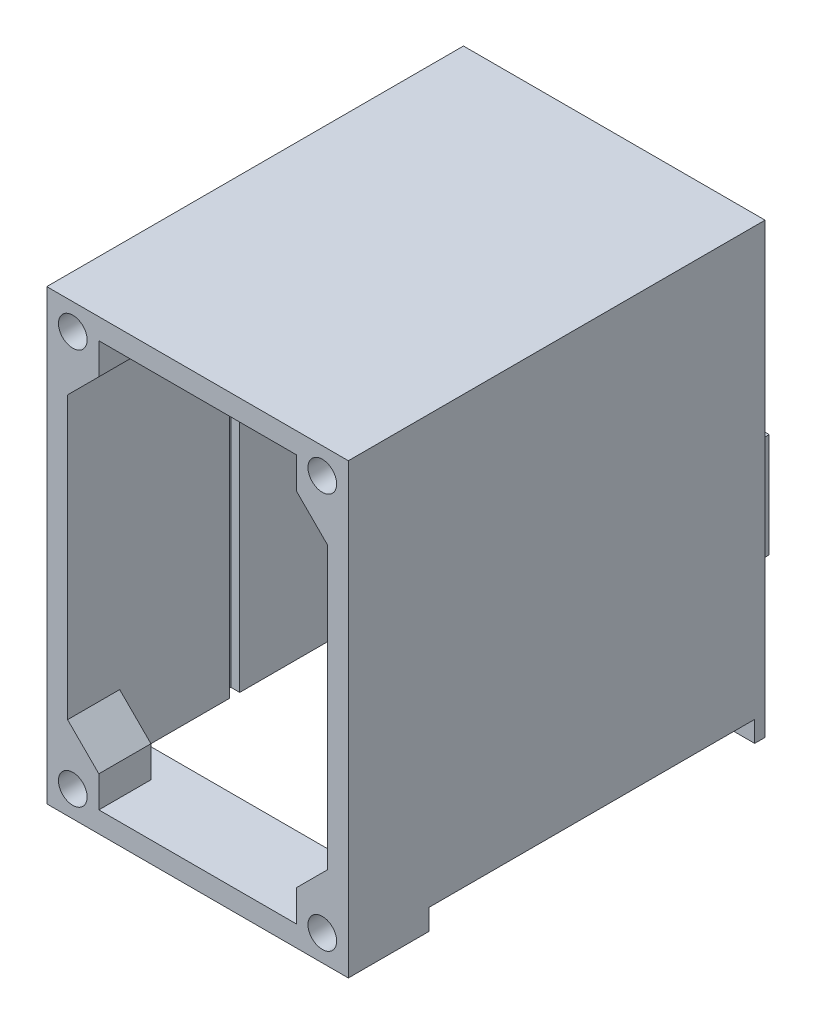
from build123d import *

# Parameters (mm, degrees)
ESQUISSE1_W              = 57.9
ESQUISSE1_H              = 86
BOSS_EXTRU_1_DEPTH       = 80
ESQUISSE2_W              = 49.9
ESQUISSE2_H              = 78
ENL_V_MAT_EXTRU_1_DEPTH  = 75
ESQUISSE3_W              = 10
ESQUISSE3_H              = 10
BOSS_EXTRU_2_DEPTH       = 10
ESQUISSE4_R              = 2.75
ENL_V_MAT_EXTRU_2_DEPTH  = 5.85
ESQUISSE47_R             = 2.25
ENL_V_MAT_EXTRU_25_DEPTH = 10
ESQUISSE19_W             = 50
ESQUISSE19_H             = 20
BOSS_EXTRU_9_DEPTH       = 4.75
CONG_1_R                 = 3
ESQUISSE29_W             = 10
ESQUISSE29_H             = 5
ENL_V_MAT_EXTRU_11_DEPTH = 100.346187647
ESQUISSE32_W             = 57.9
ESQUISSE32_H             = 62.5
ENL_V_MAT_EXTRU_16_DEPTH = 4
ESQUISSE46_W             = 3
ESQUISSE46_H             = 5.5
BOSS_EXTRU_10_DEPTH      = 78
ENL_V_START              = -1.5
ENL_V_MAT_EXTRU_20_DEPTH = 11.5
ENL_V_MAT_EXTRU_21_DEPTH = 1.7
CHANFREIN1_SIZE          = 6
ESQUISSE45_R             = 2.75
ENL_V_MAT_EXTRU_24_DEPTH = 100.346187647
ESQUISSE48_W             = 8
ESQUISSE48_H             = 4
BOSS_EXTRU_11_DEPTH      = 15
ESQUISSE49_R             = 2.75
ENL_V_MAT_EXTRU_26_DEPTH = 15
CONG_2_R                 = 2


with BuildPart() as part:
    # Esquisse1 → Boss.-Extru.1 (new body)
    with BuildSketch(Plane.XY):
        Rectangle(ESQUISSE1_W, ESQUISSE1_H)
    extrude(amount=BOSS_EXTRU_1_DEPTH)

    # Esquisse2 → Enlèv. mat.-Extru.1 (cut)
    with BuildSketch(Plane.XY.offset(80)):
        Rectangle(ESQUISSE2_W, ESQUISSE2_H)
    extrude(amount=-ENL_V_MAT_EXTRU_1_DEPTH, mode=Mode.SUBTRACT)

    # Esquisse3 → Boss.-Extru.2 (add)
    with BuildSketch(Plane.XY.offset(80)):
        with Locations((-23.95, 38)):
            Rectangle(ESQUISSE3_W, ESQUISSE3_H)
        with Locations((-23.95, -38)):
            Rectangle(ESQUISSE3_W, ESQUISSE3_H)
        with Locations((23.95, -38)):
            Rectangle(ESQUISSE3_W, ESQUISSE3_H)
        with Locations((23.95, 38)):
            Rectangle(ESQUISSE3_W, ESQUISSE3_H)
    extrude(amount=-BOSS_EXTRU_2_DEPTH)

    # Esquisse4 → Enlèv. mat.-Extru.2 (cut)
    with BuildSketch(Plane.XY.offset(80)):
        with Locations((23.95, -38)):
            Circle(ESQUISSE4_R)
        with Locations((-23.95, -38)):
            Circle(ESQUISSE4_R)
        with Locations((-23.95, 38)):
            Circle(ESQUISSE4_R)
        with Locations((23.95, 38)):
            Circle(ESQUISSE4_R)
    extrude(amount=-ENL_V_MAT_EXTRU_2_DEPTH, mode=Mode.SUBTRACT)

    # Esquisse47 → Enlèv. mat.-Extru.25 (cut)
    with BuildSketch(Plane.XY.offset(80)):
        with Locations((23.95, -38)):
            Circle(ESQUISSE47_R)
        with Locations((-23.95, -38)):
            Circle(ESQUISSE47_R)
        with Locations((-23.95, 38)):
            Circle(ESQUISSE47_R)
        with Locations((23.95, 38)):
            Circle(ESQUISSE47_R)
    extrude(amount=-ENL_V_MAT_EXTRU_25_DEPTH, mode=Mode.SUBTRACT)

    # Esquisse19 → Boss.-Extru.9 (add)
    with BuildSketch(Plane(origin=(0, 0, 0), x_dir=(-1, 0, 0), z_dir=(0, 0, -1))):
        with Locations((0, -7)):
            Rectangle(ESQUISSE19_W, ESQUISSE19_H)
    extrude(amount=BOSS_EXTRU_9_DEPTH)

    # Congé1
    cong_1_edges = [part.edges().sort_by_distance(p)[0] for p in [
        (0, -17, 0),
    ]]
    fillet(cong_1_edges, radius=CONG_1_R)

    # Esquisse29 → Enlèv. mat.-Extru.11 (cut, through all)
    with BuildSketch(Plane(origin=(0, 0, -4.75), x_dir=(-1, 0, 0), z_dir=(0, 0, -1))):
        with Locations((0, -5)):
            Rectangle(ESQUISSE29_W, ESQUISSE29_H)
    extrude(amount=-ENL_V_MAT_EXTRU_11_DEPTH, mode=Mode.SUBTRACT)

    # Esquisse32 → Enlèv. mat.-Extru.16 (cut)
    with BuildSketch(Plane.XZ.offset(43)):
        with Locations((0, 33.25)):
            Rectangle(ESQUISSE32_W, ESQUISSE32_H)
    extrude(amount=-ENL_V_MAT_EXTRU_16_DEPTH, mode=Mode.SUBTRACT)

    # Esquisse46 → Boss.-Extru.10 (add)
    with BuildSketch(Plane.XZ.offset(39)):
        with Locations((-23.45, 15.75)):
            Rectangle(ESQUISSE46_W, ESQUISSE46_H)
    boss_extru_10 = extrude(amount=-BOSS_EXTRU_10_DEPTH)

    # Esquisse38 → Enlèv. mat.-Extru.20 (cut)
    with BuildSketch(Plane(origin=(-24.95, 0, 0), x_dir=(0, 0, -1), z_dir=(1, 0, 0)).offset(ENL_V_START)):
        with BuildLine():
            Line((-16.95, -39), (-16.95, 36))
            ThreePointArc((-16.95, 36), (-15.975, 36.975), (-15, 36))
            Line((-15, 36), (-15, -39))
            ThreePointArc((-15, -39), (-15.975, -39.975), (-16.95, -39))
        make_face()
    enl_v_mat_extru_20 = extrude(amount=ENL_V_MAT_EXTRU_20_DEPTH, mode=Mode.SUBTRACT)

    # Esquisse40 → Enlèv. mat.-Extru.21 (cut)
    with BuildSketch(Plane(origin=(-24.95, 0, 0), x_dir=(0, 0, -1), z_dir=(1, 0, 0))):
        with BuildLine():
            Line((-46.95, 36), (-46.95, -39))
            ThreePointArc((-46.95, -39), (-47.925, -39.975), (-48.9, -39))
            Line((-48.9, -39), (-48.9, 36))
            ThreePointArc((-48.9, 36), (-47.925, 36.975), (-46.95, 36))
        make_face()
    enl_v_mat_extru_21 = extrude(amount=-ENL_V_MAT_EXTRU_21_DEPTH, mode=Mode.SUBTRACT)

    # Chanfrein1
    chanfrein1_edges = [part.edges().sort_by_distance(p)[0] for p in [
        (24.95, -33, 75),
        (-24.95, -33, 75),
        (24.95, 33, 75),
        (-24.95, 33, 75),
    ]]
    chamfer(chanfrein1_edges, length=CHANFREIN1_SIZE - 0.0001)  # a hair under: the kernel refuses the full size

    # Symétrie1: Boss.-Extru.10, Enlèv. mat.-Extru.20, Enlèv. mat.-Extru.21 across plane
    add(boss_extru_10.mirror(Plane(origin=(0, 0, 0), x_dir=(0, 0, 1), z_dir=(1, 0, 0))))
    add(enl_v_mat_extru_20.mirror(Plane(origin=(0, 0, 0), x_dir=(0, 0, 1), z_dir=(1, 0, 0))), mode=Mode.SUBTRACT)
    add(enl_v_mat_extru_21.mirror(Plane(origin=(0, 0, 0), x_dir=(0, 0, 1), z_dir=(1, 0, 0))), mode=Mode.SUBTRACT)

    # Esquisse45 → Enlèv. mat.-Extru.24 (cut, through all)
    with BuildSketch(Plane(origin=(0, 0, -4.75), x_dir=(-1, 0, 0), z_dir=(0, 0, -1))):
        with Locations((17, -6)):
            Circle(ESQUISSE45_R)
        with Locations((-17, -6)):
            Circle(ESQUISSE45_R)
    extrude(amount=-ENL_V_MAT_EXTRU_24_DEPTH, mode=Mode.SUBTRACT)

    # Esquisse48 → Boss.-Extru.11 (add)
    with BuildSketch(Plane.XZ.offset(39)):
        with Locations((0, 7)):
            Rectangle(ESQUISSE48_W, ESQUISSE48_H)
    extrude(amount=-BOSS_EXTRU_11_DEPTH)

    # Esquisse49 → Enlèv. mat.-Extru.26 (cut)
    with BuildSketch(Plane.XZ.offset(39)):
        with Locations(Location((0, 5.5, 0), (0, 0, 270))):
            Circle(ESQUISSE49_R)
    extrude(amount=-ENL_V_MAT_EXTRU_26_DEPTH, mode=Mode.SUBTRACT)

    # Congé2
    cong_2_edges = [part.edges().sort_by_distance(p)[0] for p in [
        (4, -31.5, 5),
        (-4, -31.5, 5),
    ]]
    fillet(cong_2_edges, radius=CONG_2_R)
    cong_2_2_edges = [part.edges().sort_by_distance(p)[0] for p in [
        (4, -31.5, 9),
        (-4, -31.5, 9),
    ]]
    fillet(cong_2_2_edges, radius=CONG_2_R - 0.0001)  # a hair under: the kernel refuses the full size


solid = part.part
